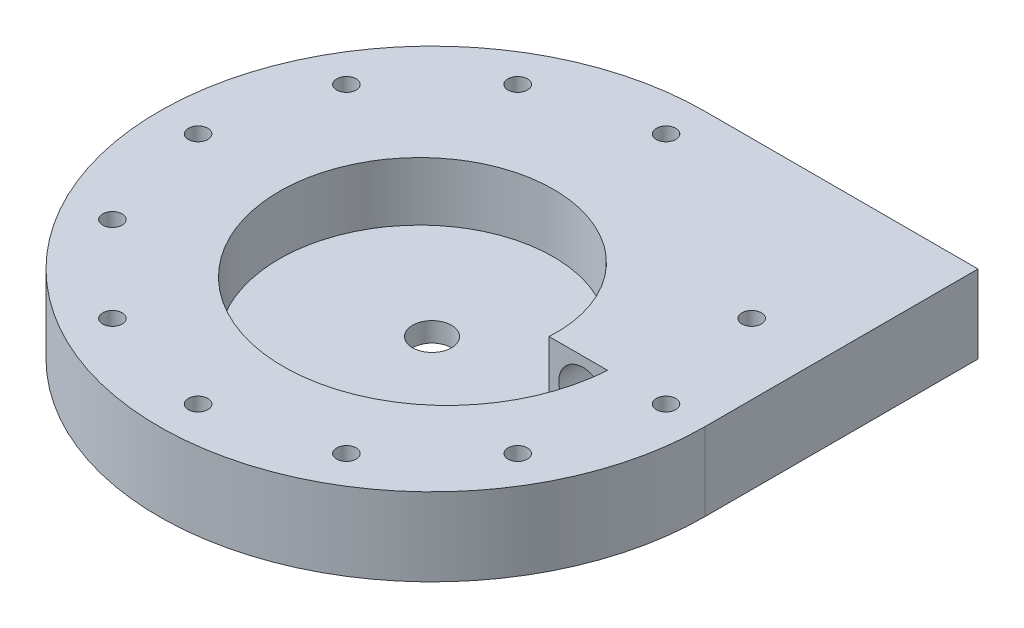
from build123d import *

# Parameters (mm, degrees)
SKETCH1_R           = 6.35
BOSS_EXTRUDE1_DEPTH = 25.4
SKETCH1_3_R         = 6.35
CUT_EXTRUDE1_DEPTH  = 19.05
SKETCH2_R           = 7.9375
CUT_EXTRUDE3_DEPTH  = 129.263712856
CIRPATTERN1_COUNT   = 12


with BuildPart() as part:
    # Sketch1 → Boss-Extrude1 (new body)
    with BuildSketch(Plane(origin=(0, 0, 0), x_dir=(1, 0, 0), z_dir=(0, 1, 0))):
        with BuildLine():
            ThreePointArc((0, 88.9), (-62.861792847, -62.861792847), (88.9, 0))
            Line((88.9, 0), (88.9, 88.9))
            Line((88.9, 88.9), (0, 88.9))
        make_face()
        Circle(SKETCH1_R, mode=Mode.SUBTRACT)
    extrude(amount=-BOSS_EXTRUDE1_DEPTH)

    # Sketch1<3> → Cut-Extrude1 (cut)
    with BuildSketch(Plane(origin=(0, 0, 0), x_dir=(1, 0, 0), z_dir=(0, 1, 0))):
        with BuildLine():
            Line((57.15, 0), (38.1, 0))
            add(Edge.make_bspline(
                [(38.1, 0), (38.104196567, 0.065031023), (38.112207842, 0.195583217), (38.126176664, 0.440876384), (38.142557673, 0.771571842), (38.157990518, 1.154772047), (38.171235997, 1.609607179), (38.18022516, 2.15183656), (38.180190318, 2.76477533), (38.16804129, 3.534196816), (38.13367419, 4.455490045), (38.064990608, 5.529852502), (37.94733507, 6.754027907), (37.790772544, 7.974123243), (37.59551179, 9.188459972), (37.361845774, 10.396093414), (37.090076945, 11.595666722), (36.780560568, 12.786094619), (36.260236212, 14.556182345), (35.443319711, 16.878013492), (34.088815499, 19.982231826), (31.963759605, 23.735168412), (29.245000433, 27.474707072), (25.878653124, 31.078416043), (22.0996836, 34.246463382), (18.483254371, 36.599725785), (14.65406305, 38.578465889), (11.219997335, 39.940895185), (8.27762035, 40.846700338), (4.675198716, 41.652734243), (1.018009014, 42.175168222), (-3.291665868, 42.367557332), (-8.209284316, 42.016659331), (-14.265134938, 40.875799714), (-21.261056783, 38.415136223), (-28.766203683, 34.052617532), (-35.122018503, 28.142758143), (-39.541648876, 22.191549685), (-43.048568006, 15.683142056), (-45.652341593, 8.564743047), (-47.130961496, -0.156773943), (-46.654939217, -10.228831884), (-44.071271342, -19.968233563), (-39.637925815, -28.827244651), (-33.518294109, -36.615159209), (-25.978437857, -43.035344671), (-17.329782279, -47.855782201), (-7.914273637, -50.91406318), (1.910318107, -52.11920776), (10.550224055, -51.534251172), (17.769170061, -49.890863591), (23.558783215, -47.793736069), (28.016093606, -45.696339569), (32.262421993, -43.199462389), (36.263637699, -40.3262584), (39.988195882, -37.102621238), (43.407390273, -33.55683764), (46.881470053, -29.239634434), (50.225624146, -24.064277187), (52.939544538, -18.526670086), (54.9867334, -12.715379226), (56.071373835, -8.227057535), (56.571947712, -5.347902309), (56.815829191, -3.519331752), (56.906489986, -2.755987253), (56.964145411, -2.221752433), (57.00967148, -1.759974767), (57.044461814, -1.381162984), (57.070496253, -1.08031027), (57.101694319, -0.693015395), (57.128353891, -0.322618205), (57.141606855, -0.130062207), (57.15, 0)],
                knots=[0.067378542, 0.067378542, 0.067378542, 0.067378542, 0.067378542, 0.068259712, 0.069140882, 0.070022052, 0.070903222, 0.072665563, 0.074427903, 0.076190244, 0.077952584, 0.081477265, 0.085001946, 0.088526627, 0.092051307, 0.095575988, 0.099100674, 0.102625359, 0.106150045, 0.109674731, 0.120248788, 0.130822843, 0.144921582, 0.159020328, 0.17311908, 0.187217836, 0.201316597, 0.208365977, 0.222464731, 0.229514108, 0.236563485, 0.250662246, 0.264761007, 0.278859756, 0.292958504, 0.32115599, 0.349353479, 0.377550966, 0.391649728, 0.40574849, 0.433946009, 0.464056799, 0.492254247, 0.520451696, 0.548649173, 0.576846649, 0.605044111, 0.633241573, 0.661439034, 0.689636495, 0.717833968, 0.731932705, 0.746031441, 0.760130179, 0.774228916, 0.788327653, 0.802426391, 0.816525136, 0.83062388, 0.851771998, 0.872920111, 0.887018851, 0.901117592, 0.904642277, 0.906404619, 0.908166962, 0.909929305, 0.910810476, 0.911691647, 0.912572818, 0.91345399, 0.915216332, 0.915216332, 0.915216332, 0.915216332, 0.915216332], degree=4))
        make_face()
        Circle(SKETCH1_3_R, mode=Mode.SUBTRACT)
    extrude(amount=-CUT_EXTRUDE1_DEPTH, mode=Mode.SUBTRACT)

    # Sketch2 → Cut-Extrude3 (cut, through all)
    with BuildSketch(Plane.XY):
        with Locations((49.2125, -11.1125)):
            Circle(SKETCH2_R)
    extrude(amount=-CUT_EXTRUDE3_DEPTH, mode=Mode.SUBTRACT)

    # Sketch3 → 1/4 (0.25) Diameter Hole1 (revolve, cut)
    with BuildSketch(Plane(origin=(76.2, 0, 0), x_dir=(0, 0, 1), z_dir=(1, 0, 0))):
        Polygon((0, 0), (0, 78.107732465), (3.175, 76.2), (3.175, 0), align=None)
    f_1_4_0_25_diameter_hole1 = revolve(axis=Axis((76.2, 6.35, 0), (0, -1, 0)), mode=Mode.SUBTRACT)

    # CirPattern1: 1/4 (0.25) Diameter Hole1 ×12 about axis, 1 skipped
    cirpattern1_axis = Axis((0, -25.4, 0), (0, 1, 0))
    add([f_1_4_0_25_diameter_hole1.rotate(cirpattern1_axis, i * 360 / CIRPATTERN1_COUNT) for i in range(1, CIRPATTERN1_COUNT) if i not in (2,)], mode=Mode.SUBTRACT)


solid = part.part
